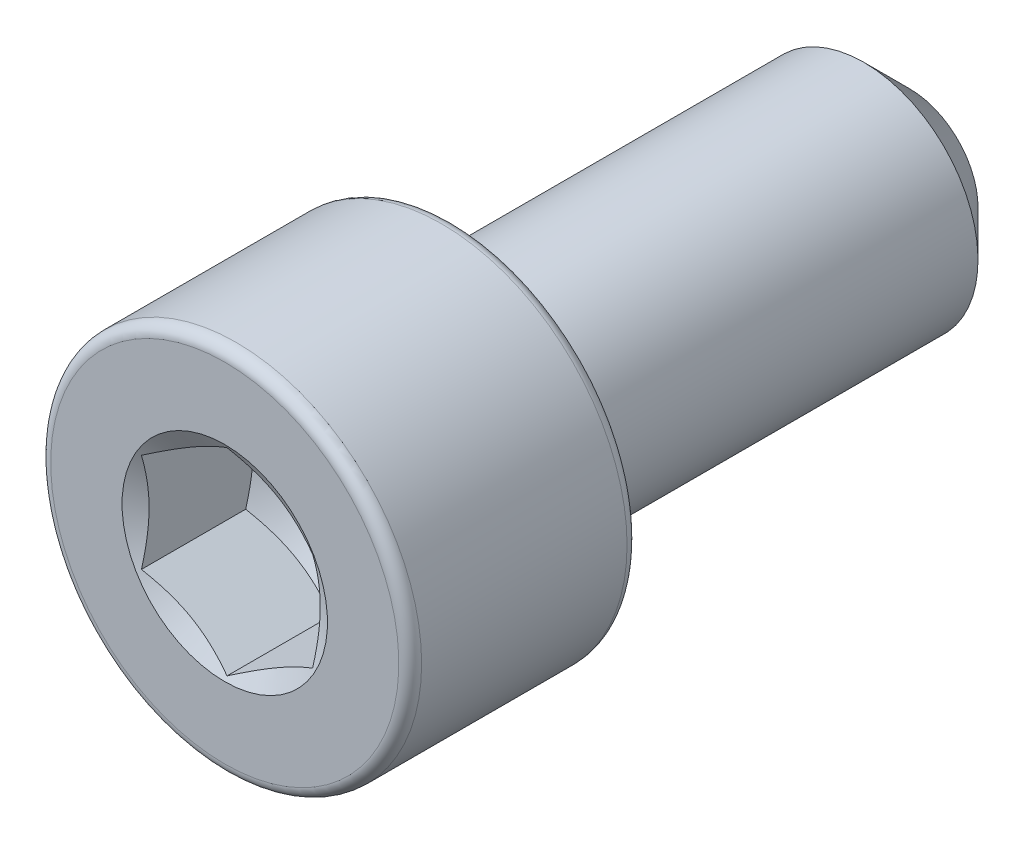
from build123d import *

# Parameters (mm, degrees)
CUT_EXTRUDE_START   = -4.0000001
CUT_EXTRUDE_1_DEPTH = 3.921539232
FILLET_1_R          = 0.4


with BuildPart() as part:
    # Эскиз1 → Повернуть1 (revolve)
    with BuildSketch(Plane(origin=(0, 0, 0), x_dir=(0, 0, -1), z_dir=(1, 0, 0))):
        with BuildLine():
            Line((16, 0), (16, 2.4))
            Line((16, 2.4), (14.4, 4))
            Line((14.4, 4), (1.02, 4))
            ThreePointArc((1.02, 4), (0.957844465, 4.004858646), (0.897198888, 4.019316553))
            Line((0.897198888, 4.019316553), (0.277198888, 4.219316553))
            ThreePointArc((0.277198888, 4.219316553), (0.076642269, 4.36454347), (0, 4.6))
            Line((0, 4.6), (0, 6.5))
            Line((0, 6.5), (-8, 6.5))
            Line((-8, 6.5), (-8, 3.6))
            Line((-8, 3.6), (-7.653589838, 3))
            Line((-7.653589838, 3), (-4, 3))
            Line((-4, 3), (-2.267949192, 0))
            Line((-2.267949192, 0), (16, 0))
        make_face()
    revolve(axis=Axis((0, 0, -16), (0, 0, 1)))

    # Вырез-Вытянуть1: read off the stored shape, not the designer's step
    # Вырез-Вытянуть1 outline → Вырез-Вытянуть1 (cut)
    with BuildSketch(Plane.XY.offset(8).offset(CUT_EXTRUDE_START)):
        with BuildLine():
            Line((3, 0), (3, 1.732050808))
            Line((3, 1.732050808), (1.499999997, 2.598076213))
            ThreePointArc((1.499999997, 2.598076213), (2.59807621, 1.500000002), (3, 0))
        make_face()
        with BuildLine():
            ThreePointArc((-1.499999956, 2.598076237), (2.4e-08, 3), (1.499999997, 2.598076213))
            Line((1.499999997, 2.598076213), (0, 3.464101615))
            Line((0, 3.464101615), (-1.499999956, 2.598076237))
        make_face()
        with BuildLine():
            Line((3, -1.732050808), (3, 0))
            ThreePointArc((3, 0), (2.59807621, -1.500000002), (1.499999997, -2.598076213))
            Line((1.499999997, -2.598076213), (3, -1.732050808))
        make_face()
        with BuildLine():
            ThreePointArc((-3, 0), (-2.598076199, 1.500000022), (-1.499999956, 2.598076237))
            Line((-1.499999956, 2.598076237), (-3, 1.732050808))
            Line((-3, 1.732050808), (-3, 0))
        make_face()
        with BuildLine():
            Line((0, -3.464101615), (1.499999997, -2.598076213))
            ThreePointArc((1.499999997, -2.598076213), (0, -3), (-1.499999997, -2.598076213))
            Line((-1.499999997, -2.598076213), (0, -3.464101615))
        make_face()
        with BuildLine():
            ThreePointArc((-1.499999997, -2.598076213), (-2.59807621, -1.500000002), (-3, 0))
            Line((-3, 0), (-3, -1.732050808))
            Line((-3, -1.732050808), (-1.499999997, -2.598076213))
        make_face()
    extrude(amount=CUT_EXTRUDE_1_DEPTH, mode=Mode.SUBTRACT)

    # Cut-Extrude 1 2 outline → Cut-Extrude 1 2 (revolve)
    with BuildSketch(Plane.XZ):
        Polygon((3.464101616, 4.267949193), (2.999999957, 3.999999975), (3.464101615, 3.9999999), align=None)
    revolve(axis=Axis((0, 0, 0), (0, 0, 1)))

    # Скругление1
    fillet_1_edges = [part.edges().sort_by_distance(p)[0] for p in [
        (0, -6.5, 0),
        (0, -6.5, 8),
    ]]
    fillet(fillet_1_edges, radius=FILLET_1_R)


solid = part.part
